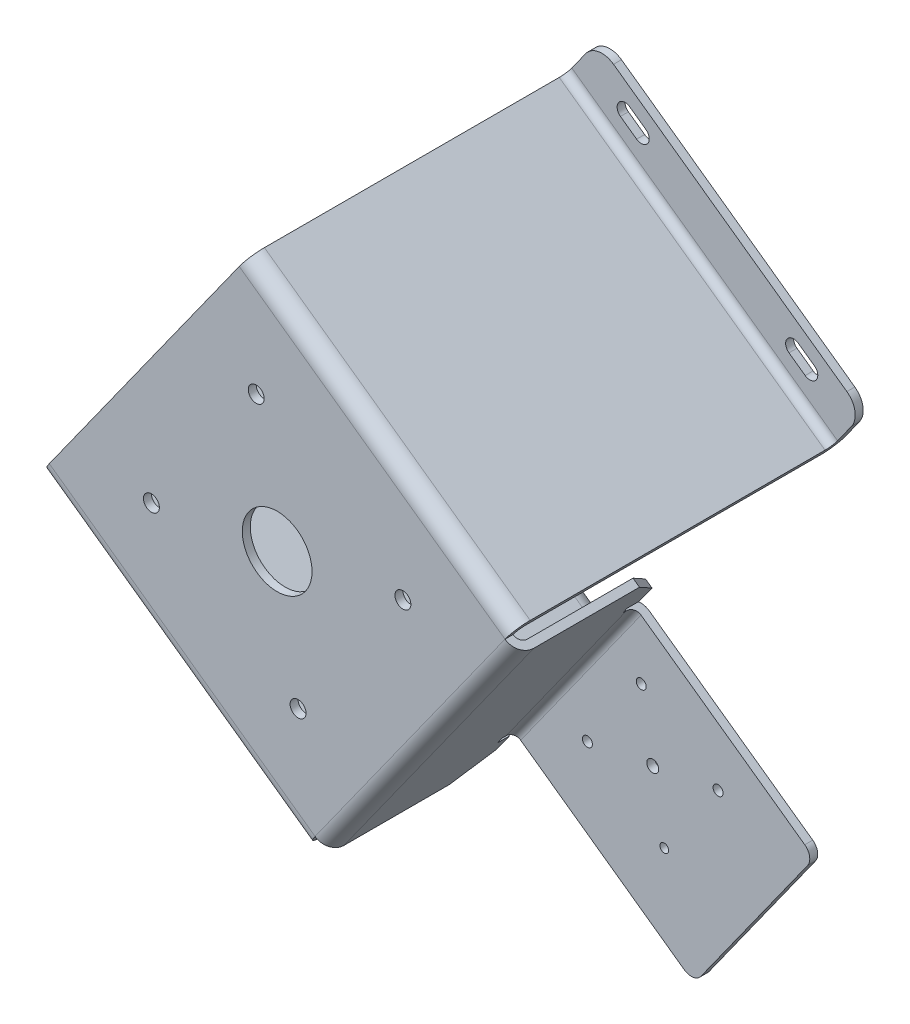
from build123d import *

# Parameters (mm, degrees)
BOSS_EXTRUDE1_DEPTH               = 3.999999999999827
BOSS_EXTRUDE2_DEPTH               = 168.00000000000006
BOSS_EXTRUDE3_DEPTH               = 33.999999999999844
BOSS_EXTRUDE4_DEPTH               = 160.00000000000026
BOSS_EXTRUDE5_DEPTH               = 33.99999999999976
BOSS_EXTRUDE6_DEPTH               = 160
CUT_EXTRUDE1_DEPTH                = 323.7305344129504
BOSS_EXTRUDE7_DEPTH               = 10
BOSS_EXTRUDE8_DEPTH               = 110.99999999999987
CUT_EXTRUDE2_DEPTH                = 320.2945688597946
CUT_EXTRUDE3_DEPTH                = 370.10495441994317
SKETCH12_R                        = 3.0000000000309623
SKETCH12_R_2                      = 2.500000000030963
SKETCH12_R_3                      = 2.192092842094092
SKETCH12_R_4                      = 2.500000000030976
CUT_EXTRUDE4_DEPTH                = 266.75584548482374
CUT_EXTRUDE11_DEPTH               = 298.4595256658518
TAP_DRILL_FOR_M33_HELICOIL1_D     = 35
TAP_DRILL_FOR_M33_HELICOIL1_DEPTH = 25
TAP_DRILL_FOR_M33_HELICOIL1_TIP   = 10.515060832982305
F_8_0_8_DIAMETER_HOLE1_D          = 8
FILLET1_R                         = 3.9999999999999907
FILLET2_R                         = 6.000000000000003
FILLET3_R                         = 8.000000000000018
FILLET4_R                         = 10.000000000000002


with BuildPart() as part:
    # Sketch1 → Boss-Extrude1 (new body)
    with BuildSketch(Plane(origin=(73.22398349105087, -52.32827382689312, 1.9235e-13), x_dir=(0.581425264743257, 0.813599816567232, 0), z_dir=(0.813599816567232, -0.581425264743257, 2.1335369341433303e-15))):
        Polygon((-81.99999999999993, -57.00000000000027), (-67.00000000000007, -72.00000000000006), (67.00000000000001, -72.00000000000007), (82.00000000000031, -57.00000000000008), (82.00000000000031, 3.99999999999992), (-81.99999999999994, 3.999999999999898), align=None)
    extrude(amount=-BOSS_EXTRUDE1_DEPTH)

    # Sketch2 → Boss-Extrude2 (add)
    with BuildSketch(Plane(origin=(69.96958422478208, -50.002572767920185, 1.8081e-13), x_dir=(1.3e-16, -9e-17, 1), z_dir=(-0.8135998165672335, 0.581425264743255, 0))):
        Polygon((4.000000000000034, 82.00000000000027), (3.9999999999999107, -82.0000000000003), (-3.307e-14, -82.00000000000033), (3.0771e-13, 81.99999999999974), align=None)
    extrude(amount=BOSS_EXTRUDE2_DEPTH)

    # Sketch3 → Boss-Extrude3 (add)
    with BuildSketch(Plane(origin=(47.67687170894727, 66.71518495851329, 4e-17), x_dir=(-0.8135998165672319, 0.5814252647432572, 0), z_dir=(0.5814252647432572, 0.8135998165672319, 1.1186917952113738e-15))):
        Polygon((81.99999999999982, 1.8349e-13), (-81.9999999999999, 3.1461e-13), (-81.99999999999989, 4.000000000000039), (81.99999999999977, 3.99999999999991), align=None)
    extrude(amount=BOSS_EXTRUDE3_DEPTH)

    # Sketch4 → Boss-Extrude4 (add)
    with BuildSketch(Plane(origin=(0, 0, 0), x_dir=(-1, 0, -1.08e-15), z_dir=(1.08e-15, 1.78e-15, -1))):
        Polygon((-116.71775772643305, 22.292712515834978), (-134.16051566873062, 46.700707012851765), (-0.7301457517048301, 142.0544504307457), (16.712612190592758, 117.64645593372894), align=None)
    extrude(amount=BOSS_EXTRUDE4_DEPTH)

    # Sketch5 → Boss-Extrude5 (add)
    with BuildSketch(Plane(origin=(-47.67687170894706, -66.71518495851302, -3.148e-14), x_dir=(0.8135998165672321, -0.581425264743257, 0), z_dir=(-0.581425264743257, -0.8135998165672321, 0))):
        Polygon((-81.99999999999984, -4.049e-14), (-81.99999999999986, 3.9999999999999343), (82.00000000000009, 3.999999999999887), (82.00000000000007, -1.4474e-13), align=None)
    extrude(amount=BOSS_EXTRUDE5_DEPTH)

    # Sketch6 → Boss-Extrude6 (add)
    with BuildSketch(Plane(origin=(0, 0, 0), x_dir=(-1, 0, -1.08e-15), z_dir=(1.08e-15, 1.78e-15, -1))):
        Polygon((116.71775772643291, -22.292712515834953), (134.1605156687307, -46.70070701285208), (0.7301457517046283, -142.05445043074596), (-16.712612190593134, -117.64645593372893), align=None)
    extrude(amount=BOSS_EXTRUDE6_DEPTH)

    # Sketch7 → Cut-Extrude1 (cut, through all)
    with BuildSketch(Plane(origin=(69.96958422478208, -50.002572767920185, 1.8081e-13), x_dir=(1.3e-16, -9e-17, 1), z_dir=(-0.8135998165672335, 0.581425264743255, 0))):
        Polygon((-72.00000000000006, 55.999999999999545), (-72.00000000000001, -56.00000000000032), (-66, -56.0000000000003), (-66.0000000000001, 55.99999999999955), align=None)
    extrude(amount=-CUT_EXTRUDE1_DEPTH, mode=Mode.SUBTRACT)

    # Sketch8 → Boss-Extrude7 (add)
    with BuildSketch(Plane(origin=(-4.175e-14, -4.053e-14, -65.99999999999984), x_dir=(-1, 0, 6e-16), z_dir=(-6e-16, -5.6e-16, -1))):
        Polygon((-42.98986972440265, -94.63546428838991), (-103.45809725770025, -10.021083365397134), (-100.20369799143137, -7.695382306424205), (-39.73547045813379, -92.30976322941699), align=None)
    extrude(amount=BOSS_EXTRUDE7_DEPTH)

    # Sketch9 → Boss-Extrude8 (add)
    with BuildSketch(Plane(origin=(73.22398349105089, -52.328273826893124, 1.8922e-13), x_dir=(-1.3e-16, 9e-17, -1), z_dir=(0.8135998165672335, -0.581425264743255, 0))):
        Polygon((75.99999999999976, 51.99999999999975), (75.99999999999973, -52.00000000000022), (71.99999999999974, -52.00000000000025), (71.99999999999974, 51.99999999999975), align=None)
    extrude(amount=BOSS_EXTRUDE8_DEPTH)

    # Sketch10 → Cut-Extrude2 (cut, through all)
    with BuildSketch(Plane(origin=(66.7151849585131, -47.676871708947125, 0), x_dir=(-1.3e-15, 9.3e-16, -1), z_dir=(0.813599816567232, -0.581425264743257, -1.5973110435533651e-15))):
        Polygon((-4.000000000000134, -115.99999999999963), (155.9999999999999, -115.99999999999989), (155.9999999999999, -89.99999999999983), (-4.0000000000001315, -90.00000000000009), align=None)
    extrude(amount=-CUT_EXTRUDE2_DEPTH, mode=Mode.SUBTRACT)

    # Sketch11 → Cut-Extrude3 (cut, through all)
    with BuildSketch(Plane(origin=(-66.71518495851308, 47.67687170894687, -3.556e-14), x_dir=(5.88e-15, -4.2e-15, 1), z_dir=(-0.8135998165672317, 0.5814252647432574, 7.22907031221184e-15))):
        Polygon((-156.00000000000057, 116.00000000000004), (-156.0000000000006, 90.00000000000027), (3.9999999999994076, 89.99999999999994), (3.999999999999411, 116.00000000000033), align=None)
    extrude(amount=-CUT_EXTRUDE3_DEPTH, mode=Mode.SUBTRACT)

    # Sketch12 → Cut-Extrude4 (cut, through all)
    with BuildSketch(Plane.XY.offset(-71.99999999999953)):
        with Locations((112.5661613861435, -74.99039654371168)):
            Circle(SKETCH12_R)
        with Locations((79.7674056670706, -80.77370211065036)):
            Circle(SKETCH12_R_2)
        with Locations((118.34946695308224, -107.78915226278458)):
            Circle(SKETCH12_R_3)
        with Locations((145.3649171052164, -69.20709097677297)):
            Circle(SKETCH12_R_2)
        with Locations((106.78285581920481, -42.19164082463879)):
            Circle(SKETCH12_R_4)
    extrude(amount=-CUT_EXTRUDE4_DEPTH, mode=Mode.SUBTRACT)

    # Sketch19 → Cut-Extrude11 (cut, through all)
    with BuildSketch(Plane.XY.offset(-155.99999999999974)):
        with BuildLine():
            Line((-12.348762194736109, -115.31482156365595), (-20.484760360408547, -109.50056891622312))
            ThreePointArc((-20.484760360408547, -109.50056891622312), (-26.064860685650135, -110.42926712351874), (-25.136162478354784, -116.00936744876103))
            Line((-25.136162478354784, -116.00936744876103), (-17.00016431268235, -121.82362009619386))
            ThreePointArc((-17.00016431268235, -121.82362009619386), (-11.420063987440384, -120.89492188889805), (-12.348762194736109, -115.31482156365595))
        make_face()
        with BuildLine():
            Line((-105.09914128340088, -49.032341382924876), (-96.96314311772822, -54.84659403035742))
            ThreePointArc((-96.96314311772822, -54.84659403035742), (-96.03444491043223, -60.42669435559925), (-101.61454523567414, -61.355392562895375))
            Line((-101.61454523567414, -61.355392562895375), (-109.75054340134677, -55.54113991546282))
            ThreePointArc((-109.75054340134677, -55.54113991546282), (-110.6792416086428, -49.961039590220906), (-105.09914128340088, -49.032341382924876))
        make_face()
        with BuildLine():
            Line((101.61454523567473, 61.35539256289546), (109.75054340134734, 55.54113991546285))
            ThreePointArc((109.75054340134734, 55.54113991546285), (110.67924160864335, 49.961039590220956), (105.09914128340134, 49.0323413829248))
            Line((105.09914128340134, 49.0323413829248), (96.96314311772869, 54.84659403035741))
            ThreePointArc((96.96314311772869, 54.84659403035741), (96.0344449104327, 60.42669435559949), (101.61454523567473, 61.35539256289546))
        make_face()
        with BuildLine():
            Line((25.136162478355374, 116.00936744876108), (17.000164312682962, 121.82362009619392))
            ThreePointArc((17.000164312682962, 121.82362009619392), (11.420063987440981, 120.89492188889814), (12.348762194736782, 115.31482156365615))
            Line((12.348762194736782, 115.31482156365615), (20.484760360409194, 109.50056891622333))
            ThreePointArc((20.484760360409194, 109.50056891622333), (26.064860685651034, 110.4292671235191), (25.136162478355374, 116.00936744876108))
        make_face()
    extrude(amount=-CUT_EXTRUDE11_DEPTH, mode=Mode.SUBTRACT)

    # Tap Drill for M33 Helicoil1
    with Locations(Plane(origin=(0, 0, 0), x_dir=(-1, 0, -1.08e-15), z_dir=(1.08e-15, 1.78e-15, -1))):
        with Locations((0, 0)):
            Hole(TAP_DRILL_FOR_M33_HELICOIL1_D / 2, depth=TAP_DRILL_FOR_M33_HELICOIL1_DEPTH)
            with Locations((0, 0, -(TAP_DRILL_FOR_M33_HELICOIL1_DEPTH + TAP_DRILL_FOR_M33_HELICOIL1_TIP / 2))):  # 118° drill point
                Cone(0, TAP_DRILL_FOR_M33_HELICOIL1_D / 2, TAP_DRILL_FOR_M33_HELICOIL1_TIP, mode=Mode.SUBTRACT)

    # Ø8.0 (8) Diameter Hole1 (through all)
    with Locations(Plane(origin=(0, 0, 0), x_dir=(-1, 0, -1.08e-15), z_dir=(1.08e-15, 1.78e-15, -1))):
        with Locations((10.507020801, 63.131628475), (63.131628475, -10.507020801), (-63.131628475, 10.507020801), (-10.507020801, -63.131628475)):
            Hole(F_8_0_8_DIAMETER_HOLE1_D / 2)

    # Fillet1
    fillet1_edges = [part.edges().sort_by_distance(p)[0] for p in [
        (-52.32827382689296, -73.22398349105077, -155.99999999999974),
        (50.00257276792015, 69.96958422478195, 1.787e-13),
        (-50.00257276791989, -69.96958422478194, -1.787e-13),
        (73.22398349105073, -52.32827382689332, -71.99999999999956),
        (69.96958422478191, -50.00257276792043, 3.1813e-13),
        (52.328273826892875, 73.2239834910511, -156.00000000000122),
    ]]
    fillet(fillet1_edges, radius=FILLET1_R)

    # Fillet2
    fillet2_edges = [part.edges().sort_by_distance(p)[0] for p in [
        (193.7676768966628, -74.55928775189841, -73.99999999999957),
        (133.2994493633643, -159.17366867489068, -73.99999999999957),
    ]]
    fillet(fillet2_edges, radius=FILLET2_R)

    # Fillet3
    fillet3_edges = [part.edges().sort_by_distance(p)[0] for p in [
        (-50.002572767919716, -69.96958422478166, -160.00000000000017),
        (-52.32827382689307, -73.223983491051, 4.000000000000262),
        (73.22398349105097, -52.32827382689296, 4.000000000000101),
        (69.96958422478254, -50.00257276792064, -75.99999999999986),
        (50.00257276792032, 69.96958422478224, -160.00000000000009),
        (52.32827382689298, 73.22398349105063, 3.999999999998779),
    ]]
    fillet(fillet3_edges, radius=FILLET3_R)

    # Fillet4
    fillet4_edges = [part.edges().sort_by_distance(p)[0] for p in [
        (-0.7301457517044567, -142.05445043074567, -158.00000000000006),
        (134.1605156687308, 46.70070701285205, -158.0000000000009),
        (0.7301457517050038, 142.054450430746, -158.00000000000028),
        (-134.16051566873054, -46.700707012851794, -157.99999999999994),
    ]]
    fillet(fillet4_edges, radius=FILLET4_R)


solid = part.part
